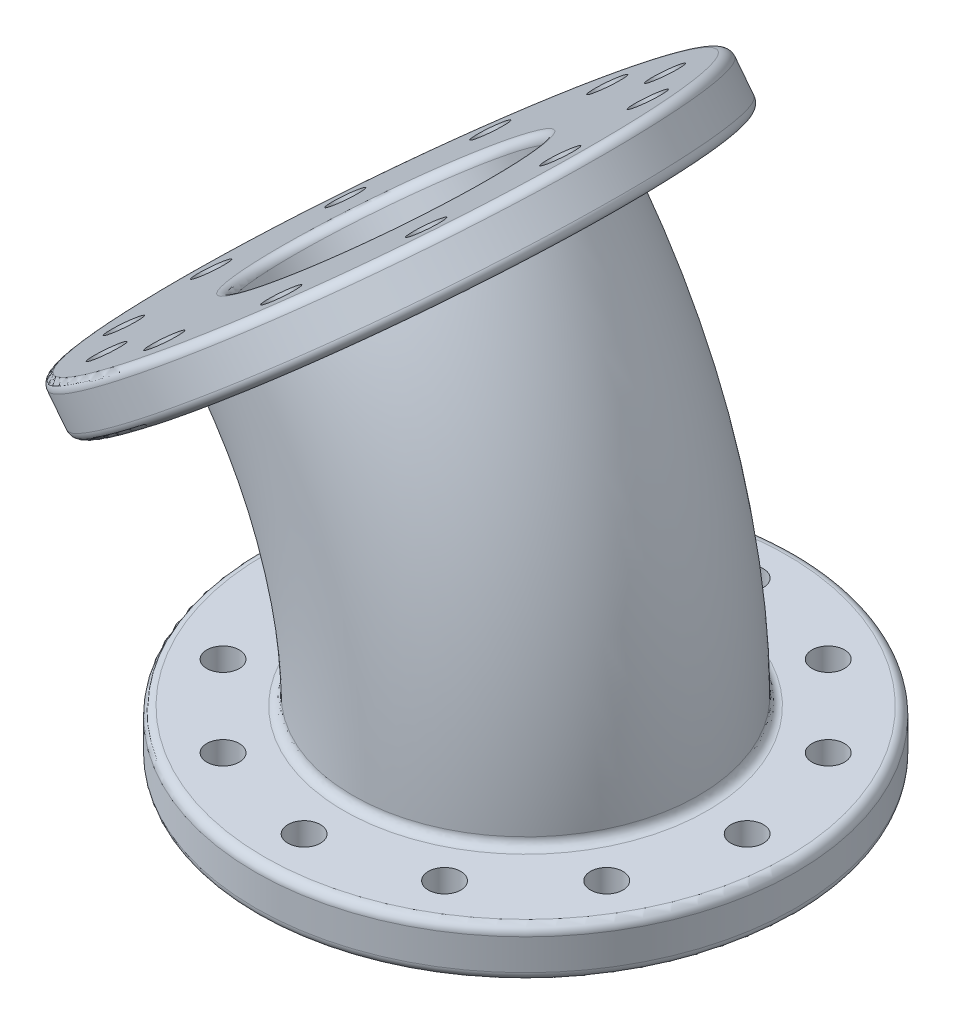
from build123d import *

# Parameters (mm, degrees)
SKETCH2_R            = 61
SKETCH2_R_2          = 3.665
SKETCH2_R_3          = 28
BOSS_EXTRUDE2_DEPTH  = 11
SKETCH6_R            = 61
SKETCH6_R_2          = 3.665
SKETCH6_R_3          = 28
BOSS_EXTRUDE3_DEPTH  = 11
REVOLVE1_OUTLINE_R   = 39
REVOLVE1_OUTLINE_R_2 = 28
REVOLVE1_ANGLE       = 38
FILLET1_R            = 2


# Read off the part's stored shape, not the designer's step: Revolve1
with BuildPart() as part:
    # Sketch2 → Boss-Extrude2 (new body)
    with BuildSketch(Plane(origin=(0, 0, 0), x_dir=(1, 0, 0), z_dir=(0, 1, 0))):
        with Locations(Location((117, 0, 0), (0, 0, 270))):
            Circle(SKETCH2_R)
        with Locations(Location((117, 50, 0), (0, 0, 270))):
            Circle(SKETCH2_R_2, mode=Mode.SUBTRACT)
        with Locations(Location((142, 43.301270189, 0), (0, 0, 270))):
            Circle(SKETCH2_R_2, mode=Mode.SUBTRACT)
        with Locations(Location((160.301270189, 25, 0), (0, 0, 270))):
            Circle(SKETCH2_R_2, mode=Mode.SUBTRACT)
        with Locations(Location((167, 0, 0), (0, 0, 270))):
            Circle(SKETCH2_R_2, mode=Mode.SUBTRACT)
        with Locations(Location((160.301270189, -25, 0), (0, 0, 270))):
            Circle(SKETCH2_R_2, mode=Mode.SUBTRACT)
        with Locations(Location((142, -43.301270189, 0), (0, 0, 270))):
            Circle(SKETCH2_R_2, mode=Mode.SUBTRACT)
        with Locations(Location((117, -50, 0), (0, 0, 270))):
            Circle(SKETCH2_R_2, mode=Mode.SUBTRACT)
        with Locations(Location((92, -43.301270189, 0), (0, 0, 270))):
            Circle(SKETCH2_R_2, mode=Mode.SUBTRACT)
        with Locations(Location((73.698729811, -25, 0), (0, 0, 270))):
            Circle(SKETCH2_R_2, mode=Mode.SUBTRACT)
        with Locations(Location((67, 0, 0), (0, 0, 270))):
            Circle(SKETCH2_R_2, mode=Mode.SUBTRACT)
        with Locations(Location((73.698729811, 25, 0), (0, 0, 270))):
            Circle(SKETCH2_R_2, mode=Mode.SUBTRACT)
        with Locations(Location((92, 43.301270189, 0), (0, 0, 270))):
            Circle(SKETCH2_R_2, mode=Mode.SUBTRACT)
        with Locations(Location((117, 0, 0), (0, 0, 270))):
            Circle(SKETCH2_R_3, mode=Mode.SUBTRACT)
    extrude(amount=-BOSS_EXTRUDE2_DEPTH)



with BuildPart() as body_2:
    # Sketch6 → Boss-Extrude3 (new body)
    with BuildSketch(Plane(origin=(0, 0, 0), x_dir=(0, 0, 1), z_dir=(-0.6156614753256595, 0.7880107536067211, 0))):
        with Locations(Location((0, 117, 0), (0, 0, 270))):
            Circle(SKETCH6_R)
        with Locations(Location((0, 167, 0), (0, 0, 270))):
            Circle(SKETCH6_R_2, mode=Mode.SUBTRACT)
        with Locations(Location((25, 160.301270189, 0), (0, 0, 270))):
            Circle(SKETCH6_R_2, mode=Mode.SUBTRACT)
        with Locations(Location((43.301270189, 142, 0), (0, 0, 270))):
            Circle(SKETCH6_R_2, mode=Mode.SUBTRACT)
        with Locations(Location((50, 117, 0), (0, 0, 270))):
            Circle(SKETCH6_R_2, mode=Mode.SUBTRACT)
        with Locations(Location((43.301270189, 92, 0), (0, 0, 270))):
            Circle(SKETCH6_R_2, mode=Mode.SUBTRACT)
        with Locations(Location((25, 73.698729811, 0), (0, 0, 270))):
            Circle(SKETCH6_R_2, mode=Mode.SUBTRACT)
        with Locations(Location((0, 67, 0), (0, 0, 270))):
            Circle(SKETCH6_R_2, mode=Mode.SUBTRACT)
        with Locations(Location((-25, 73.698729811, 0), (0, 0, 270))):
            Circle(SKETCH6_R_2, mode=Mode.SUBTRACT)
        with Locations(Location((-43.301270189, 92, 0), (0, 0, 270))):
            Circle(SKETCH6_R_2, mode=Mode.SUBTRACT)
        with Locations(Location((-50, 117, 0), (0, 0, 270))):
            Circle(SKETCH6_R_2, mode=Mode.SUBTRACT)
        with Locations(Location((-43.301270189, 142, 0), (0, 0, 270))):
            Circle(SKETCH6_R_2, mode=Mode.SUBTRACT)
        with Locations(Location((-25, 160.301270189, 0), (0, 0, 270))):
            Circle(SKETCH6_R_2, mode=Mode.SUBTRACT)
        with Locations(Location((0, 117, 0), (0, 0, 270))):
            Circle(SKETCH6_R_3, mode=Mode.SUBTRACT)
    extrude(amount=BOSS_EXTRUDE3_DEPTH)


with BuildPart() as part_1:
    add(part.part)

    add(body_2.part)  # Revolve1 merges body 2
    # Revolve1 outline → Revolve1 (revolve)
    with BuildSketch(Plane.XZ):
        with Locations((117, 0)):
            Circle(REVOLVE1_OUTLINE_R)
        with Locations((117, 0)):
            Circle(REVOLVE1_OUTLINE_R_2, mode=Mode.SUBTRACT)
    revolve(axis=Axis((0, 0, 0), (0, 0, 1)), revolution_arc=REVOLVE1_ANGLE)

    # Fillet1
    fillet1_edges = [part_1.edges().sort_by_distance(p)[0] for p in [
        (117, 0, -61),
        (78, 0, 0),
        (61.464838781, 48.021595075, 0),
        (107.489283044, 97.939032212, 0),
        (140.265914142, 109.587742608, 0),
        (133.493637913, 118.255860898, 0),
        (117, -11, -28),
        (117, -11, -61),
    ]]
    fillet(fillet1_edges, radius=FILLET1_R)


solid = part_1.part
